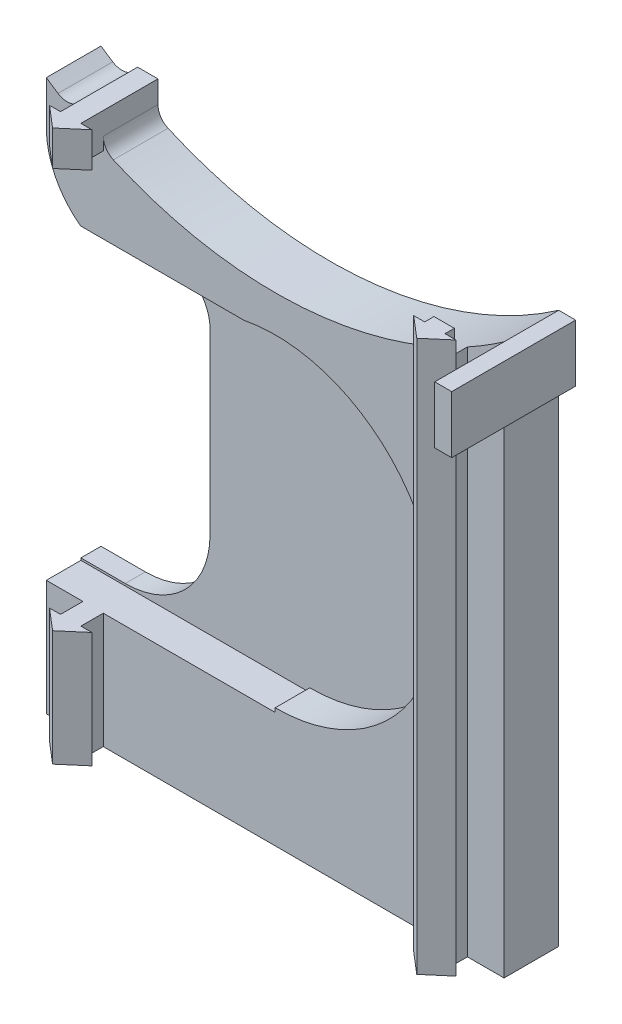
from build123d import *

# Parameters (mm, degrees)
SALIENTE_EXTRUIR1_DEPTH = 100
SKETCH3_W               = 10.723679857
SKETCH3_H               = 38.227553418
CUT_EXTRUDE1_DEPTH      = 27
SKETCH5_R               = 19.056213919
CUT_EXTRUDE2_DEPTH      = 4.078011603
CUT_EXTRUDE3_DEPTH      = 8
SKETCH7_W               = 15.237542525
SKETCH7_H               = 35.999775061
CUT_EXTRUDE4_DEPTH      = 5.8
FILLET1_R               = 10
FILLET2_R               = 10
FILLET3_R               = 5
SKETCH8_W               = 14.627019037
SKETCH8_H               = 6.752783555
BOSS_EXTRUDE1_DEPTH     = 2
SKETCH11_W              = 54
SKETCH11_H              = 35
CUT_EXTRUDE6_DEPTH      = 19
SKETCH12_W              = 5.502183779
SKETCH12_H              = 5.157792635
CUT_EXTRUDE7_DEPTH      = 9
BOSS_EXTRUDE2_START     = 8
BOSS_EXTRUDE2_DEPTH     = 8
FILLET4_R               = 2
FILLET5_R               = 2


with BuildPart() as part:
    # Croquis1 → Saliente-Extruir1 (new body)
    with BuildSketch(Plane(origin=(0, 0, 0), x_dir=(1, 0, 0), z_dir=(0, 1, 0))):
        Polygon((-22.831092882, -9.100137773), (-21.539334245, -9.100137773), (-21.539334245, -6.453403554), (-25.857066178, -6.453403554), (-25.857066178, 0), (28.142933822, 0), (28.142933822, -6.453403554), (23.825201889, -6.453403554), (23.825201889, -9.100137773), (25.116960526, -9.100137773), (22.625201889, -11.232188763), (20.133443253, -9.100137773), (21.425201889, -9.100137773), (21.425201889, -6.453403554), (-19.139334245, -6.453403554), (-19.139334245, -9.100137773), (-17.847575609, -9.100137773), (-20.339334245, -11.232188763), align=None)
    extrude(amount=SALIENTE_EXTRUIR1_DEPTH)

    # Sketch3 → Cut-Extrude1 (cut)
    with BuildSketch(Plane.ZY.offset(25.857066178)):
        with Locations((7.73723188, 67.748563888)):
            Rectangle(SKETCH3_W, SKETCH3_H)
    extrude(amount=-CUT_EXTRUDE1_DEPTH, mode=Mode.SUBTRACT)

    # Sketch5 → Cut-Extrude2 (cut)
    with BuildSketch(Plane.XY.offset(6.453403554)):
        with Locations((1.142933822, 68.165450094)):
            Circle(SKETCH5_R)
    extrude(amount=-CUT_EXTRUDE2_DEPTH, mode=Mode.SUBTRACT)

    # Sketch6 → Cut-Extrude3 (cut)
    with BuildSketch(Plane(origin=(0, 0, 0), x_dir=(-1, 0, 0), z_dir=(0, 0, -1))):
        with BuildLine():
            ThreePointArc((-28.142933822, 100), (-1.142933822, 91.515299145), (25.857066178, 100))
            ThreePointArc((25.857066178, 100), (-1.142933822, 109.141720496), (-28.142933822, 100))
        make_face()
    extrude(amount=-CUT_EXTRUDE3_DEPTH, mode=Mode.SUBTRACT)

    # Sketch7 → Cut-Extrude4 (cut)
    with BuildSketch(Plane(origin=(0, 0, 0), x_dir=(-1, 0, 0), z_dir=(0, 0, -1))):
        with Locations((18.238294915, 66.88524583)):
            Rectangle(SKETCH7_W, SKETCH7_H)
    extrude(amount=-CUT_EXTRUDE4_DEPTH, mode=Mode.SUBTRACT)

    # Fillet1
    fillet1_edges = [part.edges().sort_by_distance(p)[0] for p in [
        (-25.857066178, 84.885133361, 1.187695976),
    ]]
    fillet(fillet1_edges, radius=FILLET1_R)

    # Fillet2
    fillet2_edges = [part.edges().sort_by_distance(p)[0] for p in [
        (-10.619523653, 48.8853583, 1.187695976),
    ]]
    fillet(fillet2_edges, radius=FILLET2_R)

    # Fillet3
    fillet3_edges = [part.edges().sort_by_distance(p)[0] for p in [
        (-10.619523653, 84.885133361, 1.187695976),
    ]]
    fillet(fillet3_edges, radius=FILLET3_R)

    # Sketch8 → Boss-Extrude1 (add)
    with BuildSketch(Plane(origin=(28.142933822, 0, 0), x_dir=(0, 0, -1), z_dir=(1, 0, 0))):
        with Locations((-7.313509519, 96.623608222)):
            Rectangle(SKETCH8_W, SKETCH8_H)
    extrude(amount=BOSS_EXTRUDE1_DEPTH)

    # Sketch11 → Cut-Extrude6 (cut)
    with BuildSketch(Plane(origin=(0, 0, 0), x_dir=(-1, 0, 0), z_dir=(0, 0, -1))):
        with Locations((-1.142933822, 17.5)):
            Rectangle(SKETCH11_W, SKETCH11_H)
    extrude(amount=-CUT_EXTRUDE6_DEPTH, mode=Mode.SUBTRACT)

    # Sketch12 → Cut-Extrude7 (cut)
    with BuildSketch(Plane.XZ.offset(-86.862340597)):
        with Locations((-20.48547756, 9.032299872)):
            Rectangle(SKETCH12_W, SKETCH12_H)
    extrude(amount=-CUT_EXTRUDE7_DEPTH, mode=Mode.SUBTRACT)

    # Sketch13 → Boss-Extrude2 (add)
    with BuildSketch(Plane(origin=(0, 0, 8), x_dir=(-1, 0, 0), z_dir=(0, 0, -1)).offset(BOSS_EXTRUDE2_START)):
        with BuildLine():
            Line((21.539334245, 100), (19.139334245, 100))
            Line((19.139334245, 100), (19.139334245, 96.095020365))
            ThreePointArc((19.139334245, 96.095020365), (20.348097119, 96.6915372), (21.539334245, 97.322325698))
            Line((21.539334245, 97.322325698), (21.539334245, 100))
        make_face()
    extrude(amount=-BOSS_EXTRUDE2_DEPTH)

    # Fillet4
    # the kernel refuses this fillet: 2 mm, written as the material it adds along each edge
    with BuildSketch(Plane(origin=(-21.539334245, 97.322325698, 0), x_dir=(0, 1, 0), z_dir=(0, 0, 1))) as fillet4_piece_1:
        with BuildLine():
            CenterArc((3.431070837, 1.852672033), FILLET4_R, 147.126635273, 100.744049636)
            Line((1.751326275, 2.938240182), (1.717731384, 2.959951545))
            ThreePointArc((1.717731384, 2.959951545), (0.814679242, 1.505469297), (-0.035079002, 0.019221436))
            Line((-0.035079002, 0.019221436), (0, -0.04))
            ThreePointArc((0, -0.04), (1.338837151, -0.04), (2.662606371, -0.037053441))
            Line((2.662606371, -0.037053441), (2.677674302, 0))
        make_face()
    extrude(amount=6.453403554)

    # Fillet5
    fillet5_edges = [part.edges().sort_by_distance(p)[0] for p in [
        (-19.139334245, 96.095020365, 3.226701777),
    ]]
    fillet(fillet5_edges, radius=FILLET5_R)


solid = part.part
